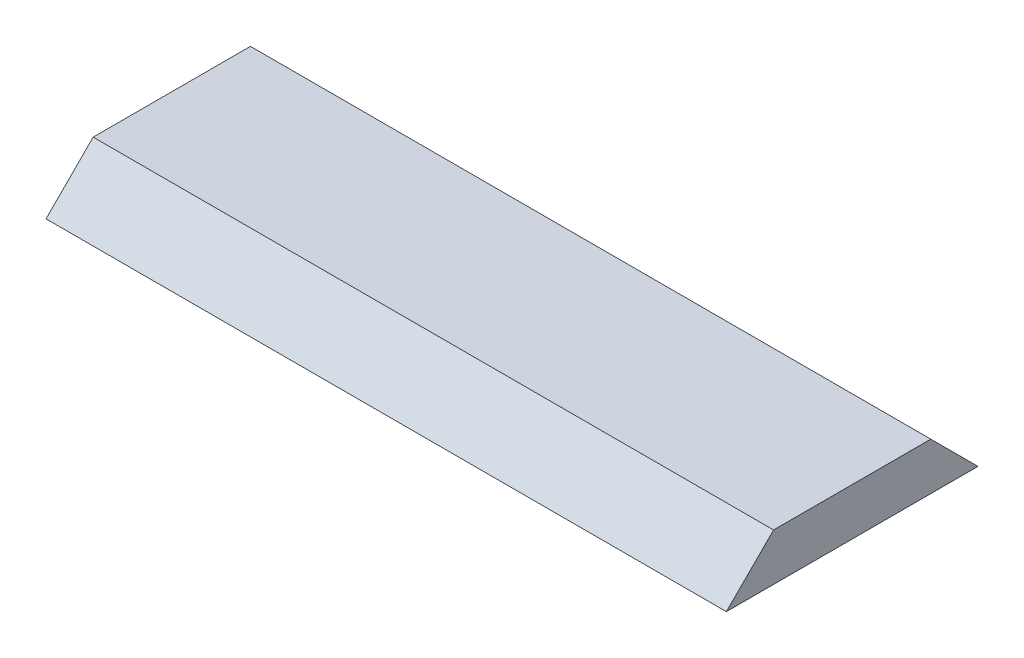
from build123d import *

# Parameters (mm, degrees)
SKETCH1_W           = 129.8
SKETCH1_H           = 50
BOSS_EXTRUDE1_DEPTH = 9
SKETCH2_R           = 2.35
CUT_EXTRUDE1_DEPTH  = 8
CHAMFER1_SIZE       = 1
CHAMFER2_SIZE       = 10


with BuildPart() as part:
    # Sketch1 → Boss-Extrude1 (new body)
    with BuildSketch(Plane(origin=(0, 0, 0), x_dir=(1, 0, 0), z_dir=(0, 1, 0))):
        Rectangle(SKETCH1_W, SKETCH1_H)
    extrude(amount=BOSS_EXTRUDE1_DEPTH)

    # Sketch2 → Cut-Extrude1 (cut)
    with BuildSketch(Plane.XZ):
        with Locations(Location((-32.45, 12.5, 0), (0, 0, 270))):
            Circle(SKETCH2_R)
        with Locations(Location((0, 12.5, 0), (0, 0, 270))):
            Circle(SKETCH2_R)
        with Locations(Location((32.45, 12.5, 0), (0, 0, 270))):
            Circle(SKETCH2_R)
        with Locations(Location((32.45, -12.5, 0), (0, 0, 90))):
            Circle(SKETCH2_R)
        with Locations(Location((0, -12.5, 0), (0, 0, 90))):
            Circle(SKETCH2_R)
        with Locations(Location((-32.45, -12.5, 0), (0, 0, 90))):
            Circle(SKETCH2_R)
    extrude(amount=-CUT_EXTRUDE1_DEPTH, mode=Mode.SUBTRACT)

    # Chamfer1
    chamfer1_edges = [part.edges().sort_by_distance(p)[0] for p in [
        (-32.45, 0, -14.85),
        (0, 0, -14.85),
        (32.45, 0, -14.85),
        (32.45, 0, 14.85),
        (0, 0, 14.85),
        (-32.45, 0, 14.85),
    ]]
    chamfer(chamfer1_edges, length=CHAMFER1_SIZE)

    # Chamfer2
    # the kernel refuses this chamfer: 10 mm, written as the material it takes off along each edge
    with BuildSketch(Plane(origin=(90.61682988, 9, 25), x_dir=(0, -0.9996219169112968, 0.027495876610586317), z_dir=(-1, 0, 0)), Plane(origin=(-90.61682988, 9, -25), x_dir=(0, -0.9996219169112968, -0.027495876610586317), z_dir=(1, 0, 0))) as chamfer2_piece_1:
        Polygon((CHAMFER2_SIZE * 0.999621916911, -CHAMFER2_SIZE * 0.0274958766106), (-CHAMFER2_SIZE * 0.0274958766106, -CHAMFER2_SIZE * 0.999621916911), (0, 0), align=None)
    extrude(amount=181.233659759, mode=Mode.SUBTRACT)


solid = part.part
